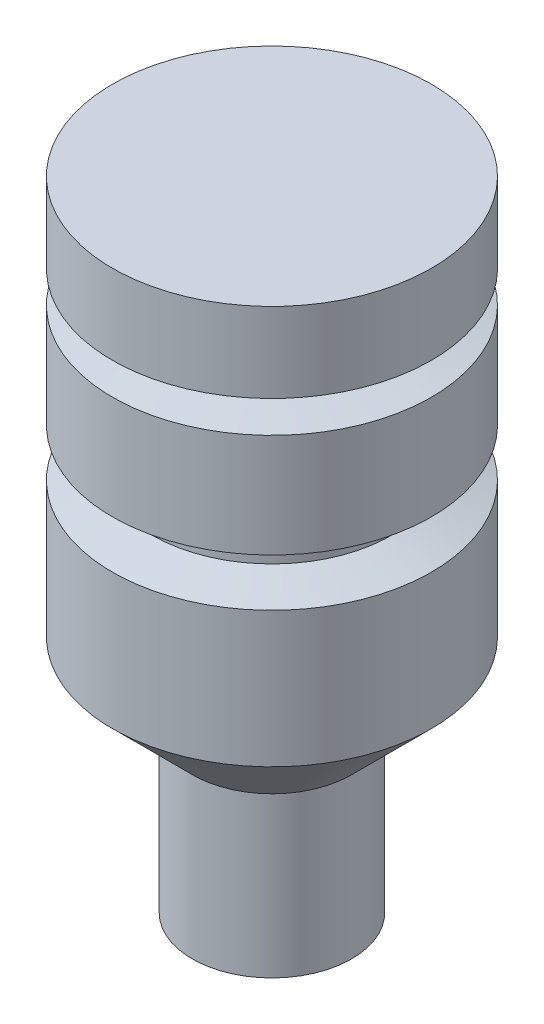
from build123d import *

# Parameters (mm, degrees)
M3_GEWINDEBOHRUNG1_D     = 2.5
M3_GEWINDEBOHRUNG1_DEPTH = 20
M3_GEWINDEBOHRUNG1_TIP   = 0.751075774


with BuildPart() as part:
    # Esboço1 → Revolução1 (revolve)
    with BuildSketch(Plane.XY):
        Polygon((0, 0), (0, 40), (10, 40), (10, 35), (7.5, 34.5), (7.5, 33.5), (10, 33), (10, 26.5), (7.5, 25.75), (7.5, 24.25), (10, 23.5), (10, 15), (5, 10), (5, 0), align=None)
    revolve(axis=Axis((0, 0, 0), (0, 1, 0)))

    # M3 Gewindebohrung1
    with Locations(Plane(origin=(0, 0, 0), x_dir=(0, 0, -1), z_dir=(0, -1, 0))):
        with Locations((0, 0)):
            Hole(M3_GEWINDEBOHRUNG1_D / 2, depth=M3_GEWINDEBOHRUNG1_DEPTH)
            with Locations((0, 0, -(M3_GEWINDEBOHRUNG1_DEPTH + M3_GEWINDEBOHRUNG1_TIP / 2))):  # 118° drill point
                Cone(0, M3_GEWINDEBOHRUNG1_D / 2, M3_GEWINDEBOHRUNG1_TIP, mode=Mode.SUBTRACT)


solid = part.part
